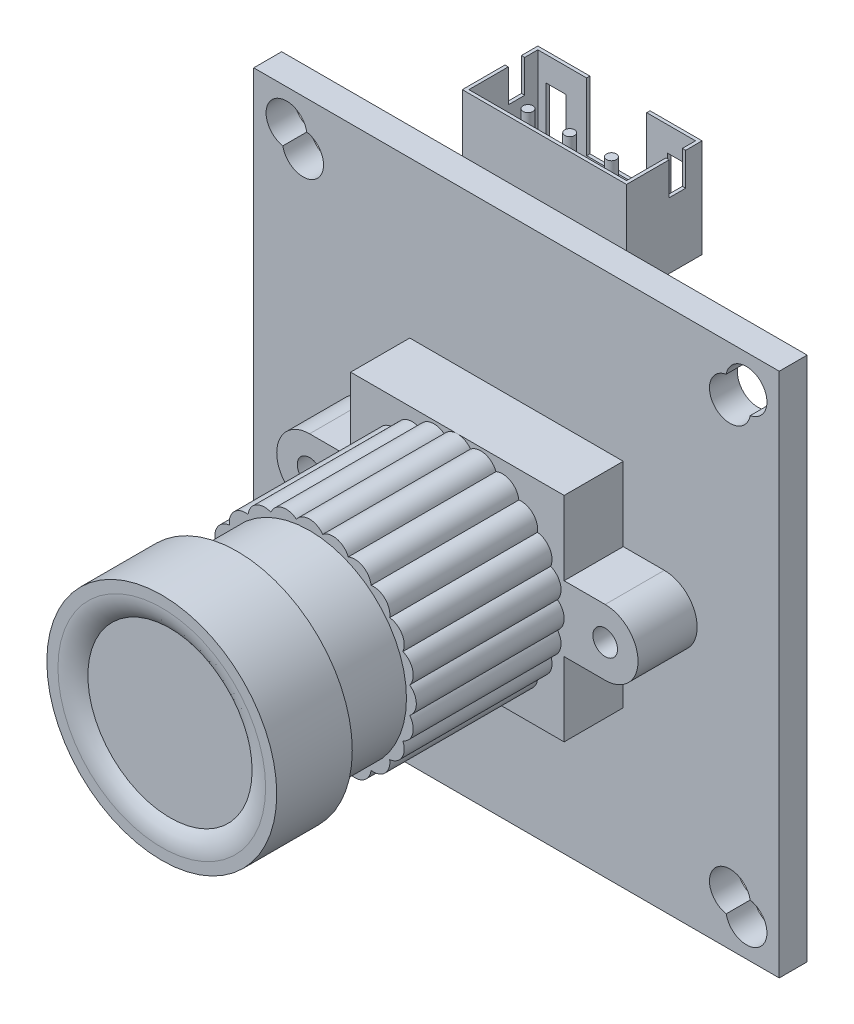
from build123d import *

# Parameters (mm, degrees)
SKETCH_1_W          = 32
SKETCH_1_H          = 32
EXTRUDE_1_DEPTH     = 1.7
SKETCH_3_R          = 0.75
EXTRUDE_2_DEPTH     = 3.6
EXTRUDE_3_DEPTH     = 9
SKETCH_6_R          = 5.9
EXTRUDE_4_DEPTH     = 4.4
SKETCH_8_R          = 7
EXTRUDE_5_DEPTH     = 4.6
SKETCH_10_R         = 5
CUT_EXTRUDE_1_DEPTH = 0.5
FILLET_1_R          = 2
SKETCH_11_W         = 10
SKETCH_11_H         = 6
EXTRUDE_6_DEPTH     = 4.6
SHELL_START         = 0.2
SHELL_1_2_DEPTH     = 13.9
SHELL_1_3_OUTLINE_W = 31.6
SHELL_1_3_OUTLINE_H = 31.6
SHELL_1_3_DEPTH     = 1.3
SHELL_START_2       = -4.4
SHELL_1_4_OUTLINE_W = 9.6
SHELL_1_4_OUTLINE_H = 5.8
SHELL_1_4_DEPTH     = 4.2
SHELL_START_3       = 1.5
SHELL_1_5_OUTLINE_R = 0.95
SHELL_1_5_DEPTH     = 3.6
SHELL_START_4       = -0.2
SHELL_1_6_OUTLINE_W = 9.6
SHELL_1_6_OUTLINE_H = 2.1
SHELL_1_6_DEPTH     = 0.4
CUT_EXTRUDE_2_REACH = 39.612
SKETCH_12_W         = 3.66
SKETCH_12_H         = 4.1
SKETCH_12_W_2       = 1.2
SKETCH_12_H_2       = 3
SKETCH_13_W         = 1
SKETCH_13_H         = 2
CUT_EXTRUDE_3_DEPTH = 37.934265933
SKETCH_14_R         = 0.3
EXTRUDE_7_DEPTH     = 4


with BuildPart() as part:
    # 草图1 → 凸台-拉伸1 (new body)
    with BuildSketch(Plane.XY):
        Rectangle(SKETCH_1_W, SKETCH_1_H)
        with BuildLine():
            ThreePointArc((14.228868987, 12.771131013), (14.883883476, 14.883883476), (12.771131013, 14.228868987))
            ThreePointArc((12.771131013, 14.228868987), (12.116116524, 12.116116524), (14.228868987, 12.771131013))
        make_face(mode=Mode.SUBTRACT)
        with BuildLine():
            ThreePointArc((12.771131013, -14.228868987), (14.883883476, -14.883883476), (14.228868987, -12.771131013))
            ThreePointArc((14.228868987, -12.771131013), (12.116116524, -12.116116524), (12.771131013, -14.228868987))
        make_face(mode=Mode.SUBTRACT)
        with BuildLine():
            ThreePointArc((-14.228868987, -12.771131013), (-14.883883476, -14.883883476), (-12.771131013, -14.228868987))
            ThreePointArc((-12.771131013, -14.228868987), (-12.116116524, -12.116116524), (-14.228868987, -12.771131013))
        make_face(mode=Mode.SUBTRACT)
        with BuildLine():
            ThreePointArc((-12.771131013, 14.228868987), (-14.883883476, 14.883883476), (-14.228868987, 12.771131013))
            ThreePointArc((-14.228868987, 12.771131013), (-12.116116524, 12.116116524), (-12.771131013, 14.228868987))
        make_face(mode=Mode.SUBTRACT)
    extrude(amount=EXTRUDE_1_DEPTH)

    # 草图3 → 凸台-拉伸2 (add)
    with BuildSketch(Plane.XY.offset(1.7)):
        with BuildLine():
            Line((-9, 2), (-6.5, 2))
            Line((-6.5, 2), (-6.5, 6.5))
            Line((-6.5, 6.5), (6.5, 6.5))
            Line((6.5, 6.5), (6.5, 2))
            Line((6.5, 2), (9, 2))
            ThreePointArc((9, 2), (11, 0), (9, -2))
            Line((9, -2), (6.5, -2))
            Line((6.5, -2), (6.5, -6.5))
            Line((6.5, -6.5), (-6.5, -6.5))
            Line((-6.5, -6.5), (-6.5, -2))
            Line((-6.5, -2), (-9, -2))
            ThreePointArc((-9, -2), (-11, 0), (-9, 2))
        make_face()
        with Locations((-9, 0)):
            Circle(SKETCH_3_R, mode=Mode.SUBTRACT)
        with Locations((9, 0)):
            Circle(SKETCH_3_R, mode=Mode.SUBTRACT)
    extrude(amount=EXTRUDE_2_DEPTH)

    # 草图4 → 凸台-拉伸3 (add)
    with BuildSketch(Plane.XY.offset(5.3)):
        with BuildLine():
            ThreePointArc((-2.353158353, -5.681026809), (-1.682323793, -6.278517871), (-0.802618492, -6.096492713))
            ThreePointArc((-0.802618492, -6.096492713), (0, -6.5), (0.802618492, -6.096492713))
            ThreePointArc((0.802618492, -6.096492713), (1.682323793, -6.278517871), (2.353158353, -5.681026809))
            ThreePointArc((2.353158353, -5.681026809), (3.25, -5.629165125), (3.74333436, -4.878408317))
            ThreePointArc((3.74333436, -4.878408317), (4.596194078, -4.596194078), (4.878408317, -3.74333436))
            ThreePointArc((4.878408317, -3.74333436), (5.629165125, -3.25), (5.681026809, -2.353158353))
            ThreePointArc((5.681026809, -2.353158353), (6.278517871, -1.682323793), (6.096492713, -0.802618492))
            ThreePointArc((6.096492713, -0.802618492), (6.5, 0), (6.096492713, 0.802618492))
            ThreePointArc((6.096492713, 0.802618492), (6.278517871, 1.682323793), (5.681026809, 2.353158353))
            ThreePointArc((5.681026809, 2.353158353), (5.629165125, 3.25), (4.878408317, 3.74333436))
            ThreePointArc((4.878408317, 3.74333436), (4.596194078, 4.596194078), (3.74333436, 4.878408317))
            ThreePointArc((3.74333436, 4.878408317), (3.25, 5.629165125), (2.353158353, 5.681026809))
            ThreePointArc((2.353158353, 5.681026809), (1.682323793, 6.278517871), (0.802618492, 6.096492713))
            ThreePointArc((0.802618492, 6.096492713), (0, 6.5), (-0.802618492, 6.096492713))
            ThreePointArc((-0.802618492, 6.096492713), (-1.682323793, 6.278517871), (-2.353158353, 5.681026809))
            ThreePointArc((-2.353158353, 5.681026809), (-3.25, 5.629165125), (-3.74333436, 4.878408317))
            ThreePointArc((-3.74333436, 4.878408317), (-4.596194078, 4.596194078), (-4.878408317, 3.74333436))
            ThreePointArc((-4.878408317, 3.74333436), (-5.629165125, 3.25), (-5.681026809, 2.353158353))
            ThreePointArc((-5.681026809, 2.353158353), (-6.278517871, 1.682323793), (-6.096492713, 0.802618492))
            ThreePointArc((-6.096492713, 0.802618492), (-6.5, 0), (-6.096492713, -0.802618492))
            ThreePointArc((-6.096492713, -0.802618492), (-6.278517871, -1.682323793), (-5.681026809, -2.353158353))
            ThreePointArc((-5.681026809, -2.353158353), (-5.629165125, -3.25), (-4.878408317, -3.74333436))
            ThreePointArc((-4.878408317, -3.74333436), (-4.596194078, -4.596194078), (-3.74333436, -4.878408317))
            ThreePointArc((-3.74333436, -4.878408317), (-3.25, -5.629165125), (-2.353158353, -5.681026809))
        make_face()
    extrude(amount=EXTRUDE_3_DEPTH)

    # 草图6 → 凸台-拉伸4 (add)
    with BuildSketch(Plane.XY.offset(14.3)):
        Circle(SKETCH_6_R)
    extrude(amount=EXTRUDE_4_DEPTH)

    # 草图8 → 凸台-拉伸5 (add)
    with BuildSketch(Plane.XY.offset(18.7)):
        Circle(SKETCH_8_R)
    extrude(amount=EXTRUDE_5_DEPTH)

    # 草图10 → 切除-拉伸1 (cut)
    with BuildSketch(Plane.XY.offset(23.3)):
        Circle(SKETCH_10_R)
    extrude(amount=-CUT_EXTRUDE_1_DEPTH, mode=Mode.SUBTRACT)

    # 圆角1
    # the kernel refuses this fillet: 2 mm, written as the material it takes off along each edge
    with BuildSketch(Plane(origin=(0, 0, 23.3), x_dir=(1, 0, 0), z_dir=(0, -1, 0))) as fillet_1_piece_1:
        with BuildLine():
            CenterArc((6.322875656, -2), FILLET_1_R, 90, 41.409622109)
            Line((5, -0.5), (4.973542487, -0.47))
            ThreePointArc((4.973542487, -0.47), (4.96, -0.25), (4.96, 0))
            Line((4.96, 0), (5, 0.04))
            Line((5, 0.04), (6.322875656, 0.04))
            Line((6.322875656, 0.04), (6.322875656, 0))
        make_face()
    revolve(axis=Axis((0, 0, 23.3), (0, 0, 1)), mode=Mode.SUBTRACT)

    # 草图11 → 凸台-拉伸6 (add)
    with BuildSketch(Plane(origin=(0, 0, 0), x_dir=(-1, 0, 0), z_dir=(0, 0, -1))):
        with Locations((0, 16.5)):
            Rectangle(SKETCH_11_W, SKETCH_11_H)
    extrude(amount=EXTRUDE_6_DEPTH)

    # 抽壳1: read off the stored shape, not the designer's step
    # 抽壳1 outline → 抽壳1 (revolve, cut)
    with BuildSketch(Plane.XZ):
        with BuildLine():
            Line((0, 22.6), (0, 14.1))
            Line((0, 14.1), (5.7, 14.1))
            Line((5.7, 14.1), (5.7, 18.9))
            Line((5.7, 18.9), (6.8, 18.9))
            Line((6.8, 18.9), (6.8, 23.1))
            Line((6.8, 23.1), (6.322875656, 23.1))
            ThreePointArc((6.322875656, 23.1), (5.652055263, 22.970329309), (5.077885696, 22.6))
            Line((5.077885696, 22.6), (0, 22.6))
        make_face()
    revolve(axis=Axis((0, 0, 0), (0, 0, 1)), mode=Mode.SUBTRACT)

    # Shell 1 2 outline → Shell 1 2 (cut)
    with BuildSketch(Plane.XY.offset(SHELL_START)):
        with BuildLine():
            ThreePointArc((0.757831655, 5.756302911), (0, 6.3), (-0.757831655, 5.756302911))
            ThreePointArc((-0.757831655, 5.756302911), (-1.630559984, 6.085332706), (-2.221849991, 5.364020381))
            ThreePointArc((-2.221849991, 5.364020381), (-3.15, 5.455960044), (-3.534452921, 4.606188726))
            ThreePointArc((-3.534452921, 4.606188726), (-4.454772721, 4.454772721), (-4.606188726, 3.534452921))
            ThreePointArc((-4.606188726, 3.534452921), (-5.455960044, 3.15), (-5.364020381, 2.221849991))
            ThreePointArc((-5.364020381, 2.221849991), (-6.085332706, 1.630559984), (-5.756302911, 0.757831655))
            ThreePointArc((-5.756302911, 0.757831655), (-6.3, 0), (-5.756302911, -0.757831655))
            ThreePointArc((-5.756302911, -0.757831655), (-6.085332706, -1.630559984), (-5.364020381, -2.221849991))
            ThreePointArc((-5.364020381, -2.221849991), (-5.455960044, -3.15), (-4.606188726, -3.534452921))
            ThreePointArc((-4.606188726, -3.534452921), (-4.454772721, -4.454772721), (-3.534452921, -4.606188726))
            ThreePointArc((-3.534452921, -4.606188726), (-3.15, -5.455960044), (-2.221849991, -5.364020381))
            ThreePointArc((-2.221849991, -5.364020381), (-1.630559984, -6.085332706), (-0.757831655, -5.756302911))
            ThreePointArc((-0.757831655, -5.756302911), (0, -6.3), (0.757831655, -5.756302911))
            ThreePointArc((0.757831655, -5.756302911), (1.630559984, -6.085332706), (2.221849991, -5.364020381))
            ThreePointArc((2.221849991, -5.364020381), (3.15, -5.455960044), (3.534452921, -4.606188726))
            ThreePointArc((3.534452921, -4.606188726), (4.454772721, -4.454772721), (4.606188726, -3.534452921))
            ThreePointArc((4.606188726, -3.534452921), (5.455960044, -3.15), (5.364020381, -2.221849991))
            ThreePointArc((5.364020381, -2.221849991), (6.085332706, -1.630559984), (5.756302911, -0.757831655))
            ThreePointArc((5.756302911, -0.757831655), (6.3, 0), (5.756302911, 0.757831655))
            ThreePointArc((5.756302911, 0.757831655), (6.085332706, 1.630559984), (5.364020381, 2.221849991))
            ThreePointArc((5.364020381, 2.221849991), (5.455960044, 3.15), (4.606188726, 3.534452921))
            ThreePointArc((4.606188726, 3.534452921), (4.454772721, 4.454772721), (3.534452921, 4.606188726))
            ThreePointArc((3.534452921, 4.606188726), (3.15, 5.455960044), (2.221849991, 5.364020381))
            ThreePointArc((2.221849991, 5.364020381), (1.630559984, 6.085332706), (0.757831655, 5.756302911))
        make_face()
    extrude(amount=SHELL_1_2_DEPTH, mode=Mode.SUBTRACT)

    # Shell 1 3 outline → Shell 1 3 (cut)
    with BuildSketch(Plane.XY.offset(SHELL_START)):
        Rectangle(SHELL_1_3_OUTLINE_W, SHELL_1_3_OUTLINE_H)
        with BuildLine():
            ThreePointArc((-12.604874311, -14.395125689), (-15.025304833, -15.025304833), (-14.395125689, -12.604874311))
            ThreePointArc((-14.395125689, -12.604874311), (-11.974695167, -11.974695167), (-12.604874311, -14.395125689))
        make_face(mode=Mode.SUBTRACT)
        with BuildLine():
            ThreePointArc((14.395125689, -12.604874311), (15.025304833, -15.025304833), (12.604874311, -14.395125689))
            ThreePointArc((12.604874311, -14.395125689), (11.974695167, -11.974695167), (14.395125689, -12.604874311))
        make_face(mode=Mode.SUBTRACT)
        with BuildLine():
            ThreePointArc((-14.395125689, 12.604874311), (-15.025304833, 15.025304833), (-12.604874311, 14.395125689))
            ThreePointArc((-12.604874311, 14.395125689), (-11.974695167, 11.974695167), (-14.395125689, 12.604874311))
        make_face(mode=Mode.SUBTRACT)
        with BuildLine():
            ThreePointArc((12.604874311, 14.395125689), (15.025304833, 15.025304833), (14.395125689, 12.604874311))
            ThreePointArc((14.395125689, 12.604874311), (11.974695167, 11.974695167), (12.604874311, 14.395125689))
        make_face(mode=Mode.SUBTRACT)
        with BuildLine():
            ThreePointArc((-0.757831655, -5.756302911), (-1.630559984, -6.085332706), (-2.221849991, -5.364020381))
            ThreePointArc((-2.221849991, -5.364020381), (-3.15, -5.455960044), (-3.534452921, -4.606188726))
            ThreePointArc((-3.534452921, -4.606188726), (-4.454772721, -4.454772721), (-4.606188726, -3.534452921))
            ThreePointArc((-4.606188726, -3.534452921), (-5.455960044, -3.15), (-5.364020381, -2.221849991))
            ThreePointArc((-5.364020381, -2.221849991), (-6.085332706, -1.630559984), (-5.756302911, -0.757831655))
            ThreePointArc((-5.756302911, -0.757831655), (-6.3, 0), (-5.756302911, 0.757831655))
            ThreePointArc((-5.756302911, 0.757831655), (-6.085332706, 1.630559984), (-5.364020381, 2.221849991))
            ThreePointArc((-5.364020381, 2.221849991), (-5.455960044, 3.15), (-4.606188726, 3.534452921))
            ThreePointArc((-4.606188726, 3.534452921), (-4.454772721, 4.454772721), (-3.534452921, 4.606188726))
            ThreePointArc((-3.534452921, 4.606188726), (-3.15, 5.455960044), (-2.221849991, 5.364020381))
            ThreePointArc((-2.221849991, 5.364020381), (-1.630559984, 6.085332706), (-0.757831655, 5.756302911))
            ThreePointArc((-0.757831655, 5.756302911), (0, 6.3), (0.757831655, 5.756302911))
            ThreePointArc((0.757831655, 5.756302911), (1.630559984, 6.085332706), (2.221849991, 5.364020381))
            ThreePointArc((2.221849991, 5.364020381), (3.15, 5.455960044), (3.534452921, 4.606188726))
            ThreePointArc((3.534452921, 4.606188726), (4.454772721, 4.454772721), (4.606188726, 3.534452921))
            ThreePointArc((4.606188726, 3.534452921), (5.455960044, 3.15), (5.364020381, 2.221849991))
            ThreePointArc((5.364020381, 2.221849991), (6.085332706, 1.630559984), (5.756302911, 0.757831655))
            ThreePointArc((5.756302911, 0.757831655), (6.3, 0), (5.756302911, -0.757831655))
            ThreePointArc((5.756302911, -0.757831655), (6.085332706, -1.630559984), (5.364020381, -2.221849991))
            ThreePointArc((5.364020381, -2.221849991), (5.455960044, -3.15), (4.606188726, -3.534452921))
            ThreePointArc((4.606188726, -3.534452921), (4.454772721, -4.454772721), (3.534452921, -4.606188726))
            ThreePointArc((3.534452921, -4.606188726), (3.15, -5.455960044), (2.221849991, -5.364020381))
            ThreePointArc((2.221849991, -5.364020381), (1.630559984, -6.085332706), (0.757831655, -5.756302911))
            ThreePointArc((0.757831655, -5.756302911), (0, -6.3), (-0.757831655, -5.756302911))
        make_face(mode=Mode.SUBTRACT)
    extrude(amount=SHELL_1_3_DEPTH, mode=Mode.SUBTRACT)

    # Shell 1 4 outline → Shell 1 4 (cut)
    with BuildSketch(Plane.XY.offset(SHELL_START_2)):
        with Locations((0, 16.6)):
            Rectangle(SHELL_1_4_OUTLINE_W, SHELL_1_4_OUTLINE_H)
    extrude(amount=SHELL_1_4_DEPTH, mode=Mode.SUBTRACT)

    # Shell 1 5 outline → Shell 1 5 (cut)
    # profile 1 of 2: a face of its own
    with BuildSketch(Plane.XY.offset(SHELL_START_3)):
        with BuildLine():
            Line((-6.3, 6.3), (-6.3, 1.8))
            Line((-6.3, 1.8), (-9, 1.8))
            ThreePointArc((-9, 1.8), (-10.8, 0), (-9, -1.8))
            Line((-9, -1.8), (-6.3, -1.8))
            Line((-6.3, -1.8), (-6.3, -6.3))
            Line((-6.3, -6.3), (0, -6.3))
            ThreePointArc((0, -6.3), (-0.466346261, -6.15001628), (-0.757831655, -5.756302911))
            ThreePointArc((-0.757831655, -5.756302911), (-1.630559984, -6.085332706), (-2.221849991, -5.364020381))
            ThreePointArc((-2.221849991, -5.364020381), (-3.15, -5.455960044), (-3.534452921, -4.606188726))
            ThreePointArc((-3.534452921, -4.606188726), (-4.454772721, -4.454772721), (-4.606188726, -3.534452921))
            ThreePointArc((-4.606188726, -3.534452921), (-5.455960044, -3.15), (-5.364020381, -2.221849991))
            ThreePointArc((-5.364020381, -2.221849991), (-6.085332706, -1.630559984), (-5.756302911, -0.757831655))
            ThreePointArc((-5.756302911, -0.757831655), (-6.3, 0), (-5.756302911, 0.757831655))
            ThreePointArc((-5.756302911, 0.757831655), (-6.085332706, 1.630559984), (-5.364020381, 2.221849991))
            ThreePointArc((-5.364020381, 2.221849991), (-5.455960044, 3.15), (-4.606188726, 3.534452921))
            ThreePointArc((-4.606188726, 3.534452921), (-4.454772721, 4.454772721), (-3.534452921, 4.606188726))
            ThreePointArc((-3.534452921, 4.606188726), (-3.15, 5.455960044), (-2.221849991, 5.364020381))
            ThreePointArc((-2.221849991, 5.364020381), (-1.630559984, 6.085332706), (-0.757831655, 5.756302911))
            ThreePointArc((-0.757831655, 5.756302911), (-0.466346261, 6.15001628), (0, 6.3))
            Line((0, 6.3), (-6.3, 6.3))
        make_face()
        with Locations((-9, 0)):
            Circle(SHELL_1_5_OUTLINE_R, mode=Mode.SUBTRACT)
    # profile 2 of 2: a face of its own
    with BuildSketch(Plane.XY.offset(SHELL_START_3)):
        with BuildLine():
            Line((6.3, 6.3), (0, 6.3))
            ThreePointArc((0, 6.3), (0.466346261, 6.15001628), (0.757831655, 5.756302911))
            ThreePointArc((0.757831655, 5.756302911), (1.630559984, 6.085332706), (2.221849991, 5.364020381))
            ThreePointArc((2.221849991, 5.364020381), (3.15, 5.455960044), (3.534452921, 4.606188726))
            ThreePointArc((3.534452921, 4.606188726), (4.454772721, 4.454772721), (4.606188726, 3.534452921))
            ThreePointArc((4.606188726, 3.534452921), (5.455960044, 3.15), (5.364020381, 2.221849991))
            ThreePointArc((5.364020381, 2.221849991), (6.085332706, 1.630559984), (5.756302911, 0.757831655))
            ThreePointArc((5.756302911, 0.757831655), (6.3, 0), (5.756302911, -0.757831655))
            ThreePointArc((5.756302911, -0.757831655), (6.085332706, -1.630559984), (5.364020381, -2.221849991))
            ThreePointArc((5.364020381, -2.221849991), (5.455960044, -3.15), (4.606188726, -3.534452921))
            ThreePointArc((4.606188726, -3.534452921), (4.454772721, -4.454772721), (3.534452921, -4.606188726))
            ThreePointArc((3.534452921, -4.606188726), (3.15, -5.455960044), (2.221849991, -5.364020381))
            ThreePointArc((2.221849991, -5.364020381), (1.630559984, -6.085332706), (0.757831655, -5.756302911))
            ThreePointArc((0.757831655, -5.756302911), (0.466346261, -6.15001628), (0, -6.3))
            Line((0, -6.3), (6.3, -6.3))
            Line((6.3, -6.3), (6.3, -1.8))
            Line((6.3, -1.8), (9, -1.8))
            ThreePointArc((9, -1.8), (10.8, 0), (9, 1.8))
            Line((9, 1.8), (6.3, 1.8))
            Line((6.3, 1.8), (6.3, 6.3))
        make_face()
        with Locations((9, 0)):
            Circle(SHELL_1_5_OUTLINE_R, mode=Mode.SUBTRACT)
    extrude(amount=SHELL_1_5_DEPTH, mode=Mode.SUBTRACT)

    # Shell 1 6 outline → Shell 1 6 (cut)
    with BuildSketch(Plane.XY.offset(SHELL_START_4)):
        with Locations((0, 14.75)):
            Rectangle(SHELL_1_6_OUTLINE_W, SHELL_1_6_OUTLINE_H)
    extrude(amount=SHELL_1_6_DEPTH, mode=Mode.SUBTRACT)

    # 草图12 → 切除-拉伸2 (cut, up to next)
    with BuildSketch(Plane(origin=(0, 0, -4.6), x_dir=(-1, 0, 0), z_dir=(0, 0, -1)), mode=Mode.PRIVATE) as cut_extrude_2_sk1:
        with Locations((0, 17.45)):
            Rectangle(SKETCH_12_W, SKETCH_12_H)
    cut_extrude_2_tool1 = extrude(cut_extrude_2_sk1.sketch, amount=-CUT_EXTRUDE_2_REACH, mode=Mode.PRIVATE) & part.part
    # 草图12 → 切除-拉伸2 (cut, up to next)
    with BuildSketch(Plane(origin=(0, 0, -4.6), x_dir=(-1, 0, 0), z_dir=(0, 0, -1)), mode=Mode.PRIVATE) as cut_extrude_2_sk2:
        with Locations((-3.7, 16.5)):
            Rectangle(SKETCH_12_W_2, SKETCH_12_H_2)
    cut_extrude_2_tool2 = extrude(cut_extrude_2_sk2.sketch, amount=-CUT_EXTRUDE_2_REACH, mode=Mode.PRIVATE) & part.part
    # 草图12 → 切除-拉伸2 (cut, up to next)
    with BuildSketch(Plane(origin=(0, 0, -4.6), x_dir=(-1, 0, 0), z_dir=(0, 0, -1)), mode=Mode.PRIVATE) as cut_extrude_2_sk3:
        with Locations((3.7, 16.5)):
            Rectangle(SKETCH_12_W_2, SKETCH_12_H_2)
    cut_extrude_2_tool3 = extrude(cut_extrude_2_sk3.sketch, amount=-CUT_EXTRUDE_2_REACH, mode=Mode.PRIVATE) & part.part
    add(cut_extrude_2_tool1.solids().sort_by_distance((0, 17.45, -4.6))[0], mode=Mode.SUBTRACT)
    add(cut_extrude_2_tool2.solids().sort_by_distance((3.7, 16.5, -4.6))[0], mode=Mode.SUBTRACT)
    add(cut_extrude_2_tool3.solids().sort_by_distance((-3.7, 16.5, -4.6))[0], mode=Mode.SUBTRACT)

    # 草图13 → 切除-拉伸3 (cut, through all)
    with BuildSketch(Plane.ZY.offset(5)):
        with Locations((-3.1, 18.5)):
            Rectangle(SKETCH_13_W, SKETCH_13_H)
    extrude(amount=-CUT_EXTRUDE_3_DEPTH, mode=Mode.SUBTRACT)

    # 草图14 → 凸台-拉伸7 (add)
    with BuildSketch(Plane(origin=(0, 13.7, 0), x_dir=(1, 0, 0), z_dir=(0, 1, 0))):
        with Locations(Location((-3.8, 2.8, 0), (0, 0, 270))):
            Circle(SKETCH_14_R)
        with Locations(Location((-1.26, 2.8, 0), (0, 0, 270))):
            Circle(SKETCH_14_R)
        with Locations(Location((1.28, 2.8, 0), (0, 0, 270))):
            Circle(SKETCH_14_R)
        with Locations(Location((3.82, 2.8, 0), (0, 0, 270))):
            Circle(SKETCH_14_R)
    extrude(amount=EXTRUDE_7_DEPTH)


solid = part.part
